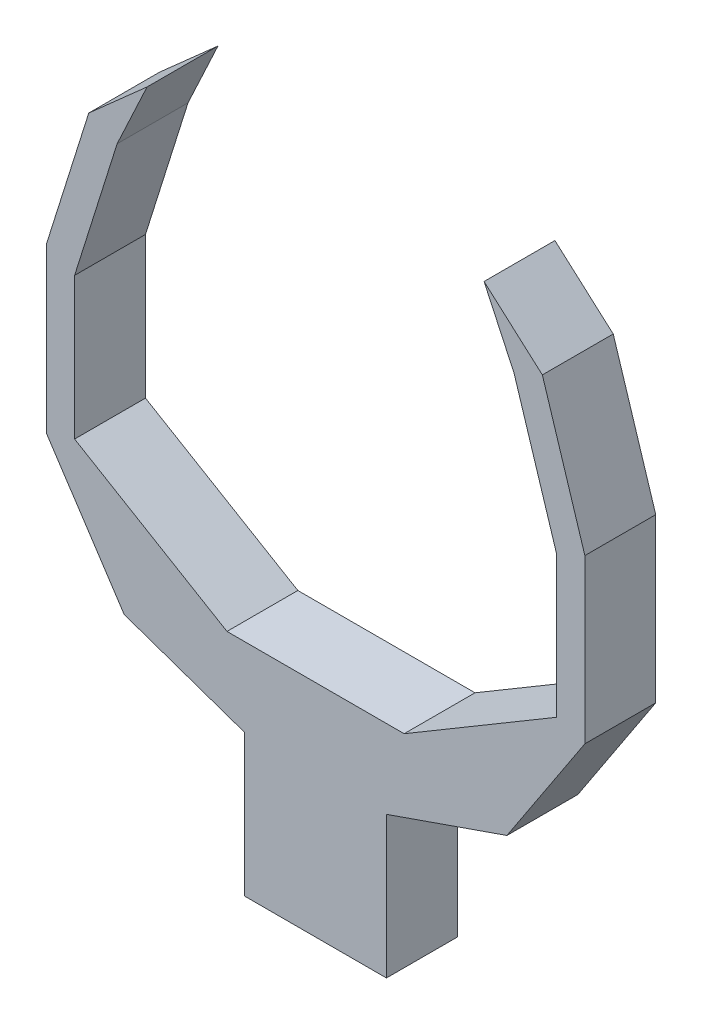
from build123d import *

# Parameters (mm, degrees)
ESQUISSE1_W             = 80
ESQUISSE1_H             = 100
BOSS_EXTRU_1_DEPTH      = 10
ENL_V_START             = -10
ENL_V_MAT_EXTRU_2_DEPTH = 10


# Read off the part's stored shape, not the designer's step: Enlèv. mat.-Extru.2
with BuildPart() as part:
    # Esquisse1 → Boss.-Extru.1 (new body)
    with BuildSketch(Plane.XY):
        Rectangle(ESQUISSE1_W, ESQUISSE1_H)
    extrude(amount=BOSS_EXTRU_1_DEPTH)

    # Enlèv. mat.-Extru.2 outline → Enlèv. mat.-Extru.2 (cut)
    with BuildSketch(Plane.XY.offset(10).offset(ENL_V_START)):
        Polygon((-40, -50), (-10, -50), (-10, -30), (-27, -24.083920217), (-38, -7.380627128), (-38, 15.619372872), (-32, 34.6981569), (-23.773026842, 42), (-28, 32.937290807), (-34, 13.858506778), (-34, -6.141493222), (-12.5, -18.898844044), (12.5, -18.898844044), (34, -6.141493222), (34, 13.858506778), (28, 32.937290807), (23.773026842, 42), (32, 34.6981569), (38, 15.619372872), (38, -7.380627128), (27, -24.083920217), (10, -30), (10, -50), (40, -50), (40, 50), (-40, 50), align=None)
    extrude(amount=ENL_V_MAT_EXTRU_2_DEPTH, mode=Mode.SUBTRACT)


solid = part.part
